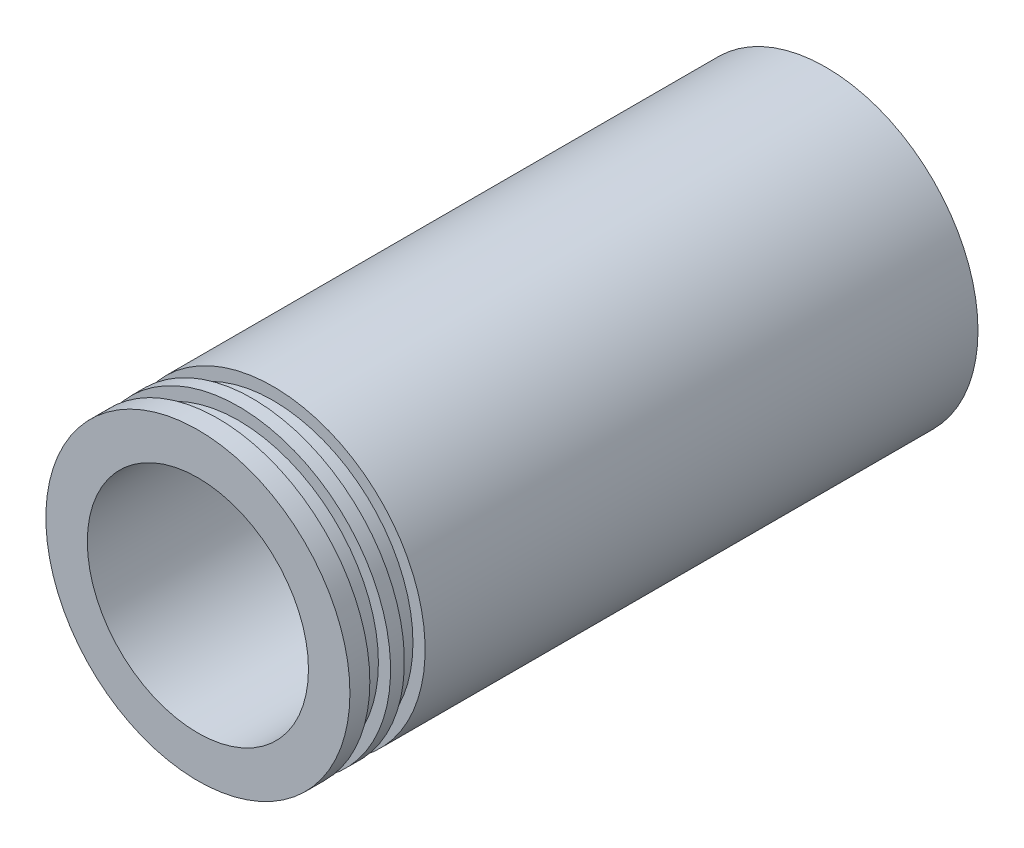
from build123d import *

# Parameters (mm, degrees)
SKETCH1_R           = 34.925
SKETCH1_R_2         = 25.4
BOSS_EXTRUDE1_DEPTH = 144.272


with BuildPart() as part:
    # Sketch1 → Boss-Extrude1 (new body)
    with BuildSketch(Plane.XY):
        Circle(SKETCH1_R)
        Circle(SKETCH1_R_2, mode=Mode.SUBTRACT)
    extrude(amount=BOSS_EXTRUDE1_DEPTH)

    # Cut-Sweep1: sweep along a path in groove path
    with BuildLine(Plane.XY.offset(131.7625)) as cut_sweep1_path:
        CenterArc((0, 0), 34.925, 0, 360)
    # groove → Cut-Sweep1 (sweep, cut)
    with BuildSketch(Plane(origin=(0, 0, 0), x_dir=(0, 0, -1), z_dir=(1, 0, 0))):
        Polygon((-139.7, 34.925), (-139.7, 32.131), (-134.9375, 32.131), (-134.9375, 34.925), (-131.7625, 34.925), (-131.7625, 32.131), (-127, 32.131), (-127, 34.925), (-127, 38.1), (-139.7, 38.1), align=None)
    sweep(path=cut_sweep1_path.line, mode=Mode.SUBTRACT)


solid = part.part
